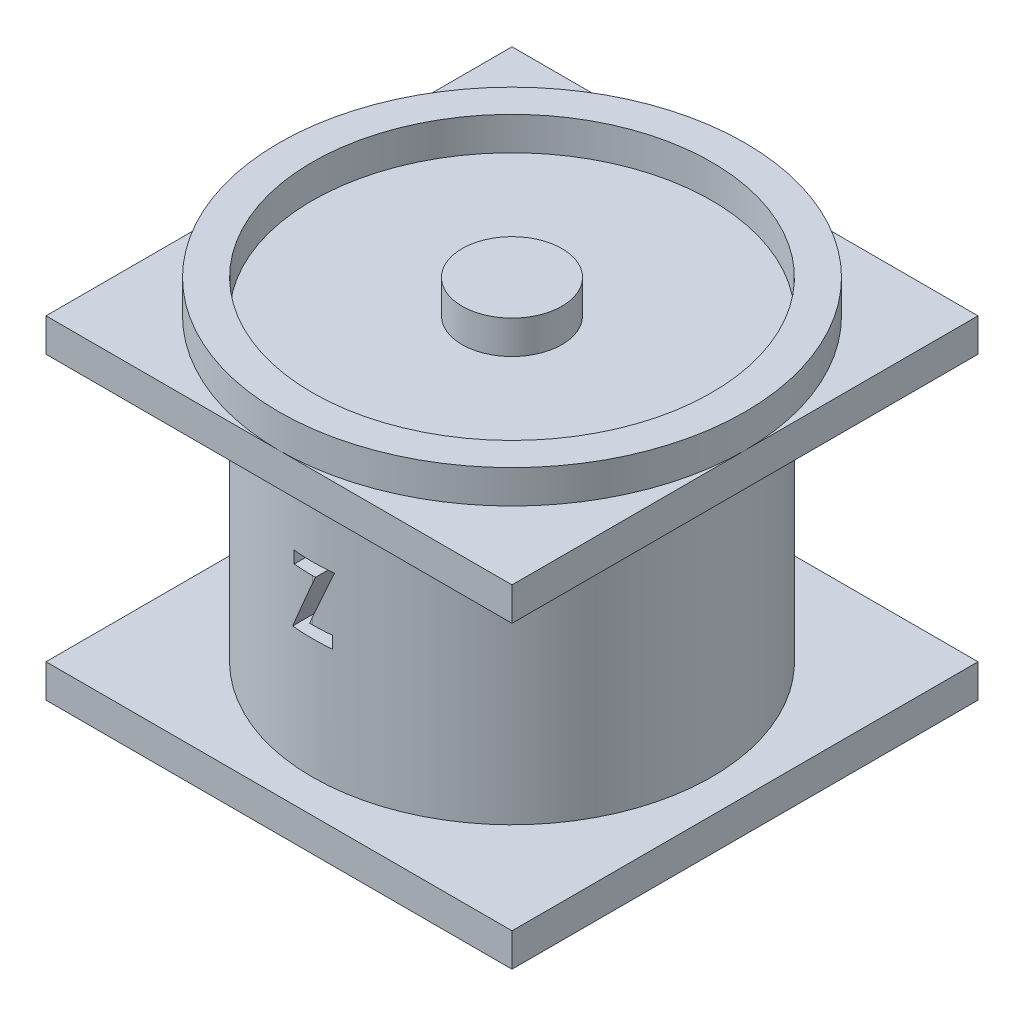
from build123d import *

# Parameters (mm, degrees)
SKETCH1_W           = 140
SKETCH1_H           = 140
BOSS_EXTRUDE1_DEPTH = 10
SKETCH2_R           = 60
BOSS_EXTRUDE2_DEPTH = 80
SKETCH3_W           = 140
SKETCH3_H           = 140
BOSS_EXTRUDE3_DEPTH = 10
SKETCH4_R           = 70
SKETCH4_R_2         = 60
BOSS_EXTRUDE4_DEPTH = 10
SKETCH5_R           = 15
BOSS_EXTRUDE5_DEPTH = 10
CUT_EXTRUDE1_DEPTH  = 10
SKETCH7_R           = 40
CUT_EXTRUDE3_DEPTH  = 80


with BuildPart() as part:
    # Sketch1 → Boss-Extrude1 (new body)
    with BuildSketch(Plane(origin=(0, 0, 0), x_dir=(1, 0, 0), z_dir=(0, 1, 0))):
        Rectangle(SKETCH1_W, SKETCH1_H)
    extrude(amount=BOSS_EXTRUDE1_DEPTH)

    # Sketch2 → Boss-Extrude2 (add)
    with BuildSketch(Plane(origin=(0, 10, 0), x_dir=(1, 0, 0), z_dir=(0, 1, 0))):
        Circle(SKETCH2_R)
    extrude(amount=BOSS_EXTRUDE2_DEPTH)

    # Sketch3 → Boss-Extrude3 (add)
    with BuildSketch(Plane(origin=(0, 90, 0), x_dir=(1, 0, 0), z_dir=(0, 1, 0))):
        Rectangle(SKETCH3_W, SKETCH3_H)
    extrude(amount=BOSS_EXTRUDE3_DEPTH)

    # Sketch4 → Boss-Extrude4 (add)
    with BuildSketch(Plane(origin=(0, 100, 0), x_dir=(1, 0, 0), z_dir=(0, 1, 0))):
        Circle(SKETCH4_R)
        Circle(SKETCH4_R_2, mode=Mode.SUBTRACT)
    extrude(amount=BOSS_EXTRUDE4_DEPTH)

    # Sketch6 → Cut-Extrude1 (cut)
    with BuildSketch(Plane.XY.offset(60)):
        Polygon((-5.699347884, 66.036762617), (6.351934167, 66.036762617), (-0.811527371, 49.626506206), (5.839113654, 49.626506206), (5.839113654, 46.036762617), (-6.212168397, 46.036762617), (0.955299552, 62.447019027), (-5.699347884, 62.447019027), align=None)
    extrude(amount=-CUT_EXTRUDE1_DEPTH, mode=Mode.SUBTRACT)

    # Sketch7 → Cut-Extrude3 (cut)
    with BuildSketch(Plane.XZ):
        Circle(SKETCH7_R)
    extrude(amount=-CUT_EXTRUDE3_DEPTH, mode=Mode.SUBTRACT)


with BuildPart() as body_2:
    # Sketch5 → Boss-Extrude5 (new, symmetric)
    with BuildSketch(Plane(origin=(0, 100, 0), x_dir=(1, 0, 0), z_dir=(0, 1, 0))):
        Circle(SKETCH5_R)
    extrude(amount=BOSS_EXTRUDE5_DEPTH, both=True)


solid = Compound([part.part, body_2.part])
